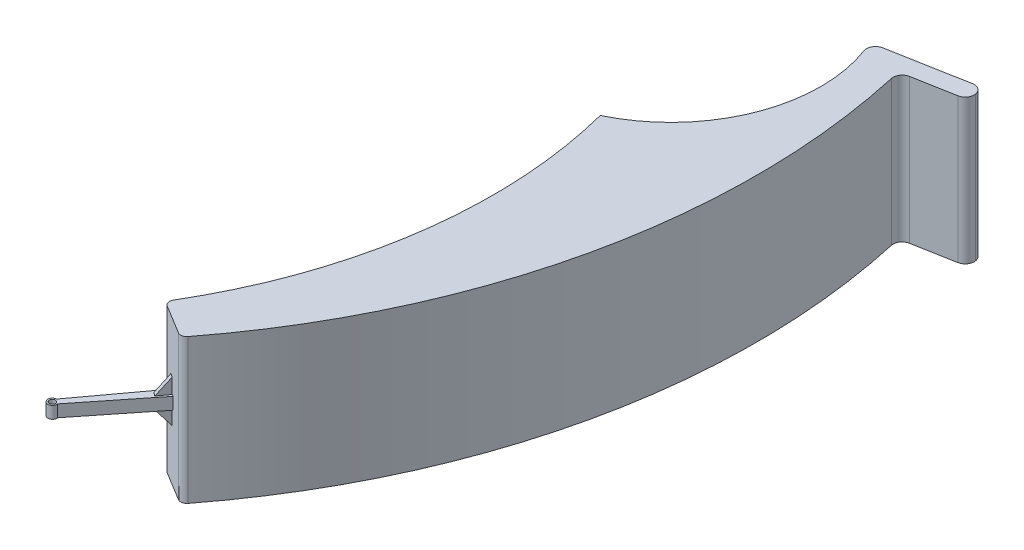
from build123d import *

# Parameters (mm, degrees)
BOSS_EXTRUDE4_DEPTH      = 24
SHELL1_T                 = -2
SKETCH9_R                = 1
CUT_EXTRUDE1_DEPTH       = 22
SKETCH6_R                = 1
BOSS_EXTRUDE5_DEPTH      = 4
BOSS_EXTRUDE6_START      = -4
SKETCH8_R                = 1
BOSS_EXTRUDE6_DEPTH      = 4
BOSS_EXTRUDE7_START      = -24
BOSS_EXTRUDE7_DEPTH      = 24
FILLET1_R                = 1
FILLET2_R                = 1.5
SKETCH12_R               = 0.5
BOSS_EXTRUDE8_DEPTH      = 24
CUT_EXTRUDE3_DEPTH       = 11
CUT_EXTRUDE4_DEPTH       = 11
BOSS_EXTRUDE9_DEPTH      = 2.5
BOSS_EXTRUDE9_DEPTH_BACK = 4.5
CUT_EXTRUDE5_DEPTH       = 0.747850193


with BuildPart() as part:
    # Sketch5 → Boss-Extrude4 (new body)
    with BuildSketch(Plane(origin=(0, 0, 0), x_dir=(1, 0, 0), z_dir=(0, 1, 0))):
        with BuildLine():
            Line((16.679736529, -62.588474268), (23.082859001, -66.493602001))
            ThreePointArc((23.082859001, -66.493602001), (44.985866831, -20.069862482), (44.587534446, 31.259921018))
            Line((44.587534446, 31.259921018), (54.42418125, 33.060026475))
            Line((54.42418125, 33.060026475), (53.884149613, 36.011020517))
            Line((53.884149613, 36.011020517), (37.98404912, 33.101303594))
            ThreePointArc((37.98404912, 33.101303594), (38.745638884, 14.245000299), (26.08183659, 0.253277589))
            ThreePointArc((26.08183659, 0.253277589), (27.736010667, -32.118438365), (16.679736529, -62.588474268))
        make_face()
    extrude(amount=BOSS_EXTRUDE4_DEPTH)

    # Shell1
    shell1_openings = [part.faces().sort_by_distance(p)[0] for p in [
        (27.736010667, 12, 32.118438365),
    ]]
    offset(amount=SHELL1_T, openings=shell1_openings, kind=Kind.INTERSECTION)

    # Sketch9 → Cut-Extrude1 (cut)
    with BuildSketch(Plane(origin=(0, 22, 0), x_dir=(-1, 0, 0), z_dir=(0, -1, 0))):
        with Locations(Location((-33, 0, 0), (0, 0, 90))):
            Circle(SKETCH9_R)
        Polygon((-18.802526646, -7.044160924), (-31.283524546, -4.66015009), (-31.283524546, 0.878893836), (-33, 1.78957842), (-36.853763417, 0.878893836), (-41.704444312, 7.207877481), (-44.902710544, 14.373324664), (-42.809869411, 29.924231084), (-24.798121137, 26.483784785), align=None)
    extrude(amount=CUT_EXTRUDE1_DEPTH, mode=Mode.SUBTRACT)

    # Sketch6 → Boss-Extrude5 (add)
    with BuildSketch(Plane(origin=(0, 24, 0), x_dir=(1, 0, 0), z_dir=(0, 1, 0))):
        with Locations(Location((33, 0, 0), (0, 0, 90))):
            Circle(SKETCH6_R)
    extrude(amount=-BOSS_EXTRUDE5_DEPTH)

    # Sketch8 → Boss-Extrude6 (add)
    with BuildSketch(Plane(origin=(0, 0, 0), x_dir=(-1, 0, 0), z_dir=(0, -1, 0)).offset(BOSS_EXTRUDE6_START)):
        with Locations(Location((-33, 0, 0), (0, 0, 270))):
            Circle(SKETCH8_R)
    extrude(amount=BOSS_EXTRUDE6_DEPTH)

    # Sketch11 → Boss-Extrude7 (add)
    with BuildSketch(Plane(origin=(0, 24, 0), x_dir=(1, 0, 0), z_dir=(0, 1, 0)).offset(BOSS_EXTRUDE7_START)):
        with BuildLine():
            Line((16.679736529, -62.588474268), (23.082859001, -66.493602001))
            ThreePointArc((23.082859001, -66.493602001), (28.946672892, -58.305690928), (34.074211637, -49.637672267))
            Line((34.074211637, -49.637672267), (24.945218618, -44.308006728))
            ThreePointArc((24.945218618, -44.308006728), (21.37536937, -53.70275106), (16.679736529, -62.588474268))
        make_face()
    extrude(amount=BOSS_EXTRUDE7_DEPTH)

    # Fillet1
    fillet1_edges = [part.edges().sort_by_distance(p)[0] for p in [
        (23.082859001, 12, 66.493602001),
        (16.679736529, 12, 62.588474268),
    ]]
    fillet(fillet1_edges, radius=FILLET1_R)

    # Fillet2
    fillet2_edges = [part.edges().sort_by_distance(p)[0] for p in [
        (39.36869634, 11, -29.266928363),
        (37.98404912, 12, -33.101303594),
        (53.884149613, 12, -36.011020517),
        (54.42418125, 12, -33.060026475),
        (44.587534446, 12, -31.259921018),
    ]]
    fillet(fillet2_edges, radius=FILLET2_R - 0.0001)  # a hair under: the kernel refuses the full size

    # Sketch12 → Boss-Extrude8 (add)
    with BuildSketch(Plane(origin=(0, 0, 0), x_dir=(1, 0, 0), z_dir=(0, 1, 0))):
        with BuildLine():
            Line((18.715601118, -63.830104629), (10.728103117, -74.664444727))
            ThreePointArc((10.728103117, -74.664444727), (10.299090631, -76.000345168), (11.504530989, -75.282295557))
            Line((11.504530989, -75.282295557), (19.996225612, -64.611130176))
            Line((19.996225612, -64.611130176), (18.715601118, -63.830104629))
        make_face()
        with Locations(Location((10.766093359, -75.413481937, 0), (0, 0, 270))):
            Circle(SKETCH12_R, mode=Mode.SUBTRACT)
    extrude(amount=BOSS_EXTRUDE8_DEPTH)

    # Sketch13 → Cut-Extrude3 (cut)
    with BuildSketch(Plane(origin=(0, 0, 0), x_dir=(1, 0, 0), z_dir=(0, 1, 0))):
        Polygon((19.996225612, -64.611130176), (24.885458438, -67.592968924), (14.482058763, -80.670297518), (6.551415536, -74.361237485), (17.528327491, -63.106011785), align=None)
    extrude(amount=CUT_EXTRUDE3_DEPTH, mode=Mode.SUBTRACT)

    # Sketch14 → Cut-Extrude4 (cut)
    with BuildSketch(Plane(origin=(0, 24, 0), x_dir=(1, 0, 0), z_dir=(0, 1, 0))):
        Polygon((19.996225612, -64.611130176), (15.918276164, -82.297397679), (4.930036713, -72.505157079), (18.705017469, -63.823649888), align=None)
    extrude(amount=-CUT_EXTRUDE4_DEPTH, mode=Mode.SUBTRACT)

    # Sketch15 → Boss-Extrude9 (add, two sides: drawn at the far end of the back side and taken through both)
    with BuildSketch(Plane(origin=(0, 13, 0), x_dir=(1, 0, 0), z_dir=(0, 1, 0)).offset(-BOSS_EXTRUDE9_DEPTH_BACK)):
        Polygon((19.018790552, -64.015013394), (17.840516782, -65.653708569), (18.447701563, -66.090293672), (19.659102799, -64.405526167), align=None)
    extrude(amount=BOSS_EXTRUDE9_DEPTH + BOSS_EXTRUDE9_DEPTH_BACK)

    # Sketch16 → Cut-Extrude5 (cut)
    with BuildSketch(Plane(origin=(43.486111653, 0, 31.267892586), x_dir=(0.5837868426462293, 0, -0.8119069665627625), z_dir=(0.8119069665627625, 0, 0.5837868426462293))):
        Polygon((-42.889644405, 13), (-40.814569828, 15.5), (-42.889644405, 15.5), align=None)
        Polygon((-42.889644405, 11), (-40.814569828, 8.5), (-42.889644405, 8.5), align=None)
    extrude(amount=-CUT_EXTRUDE5_DEPTH, mode=Mode.SUBTRACT)


solid = part.part
